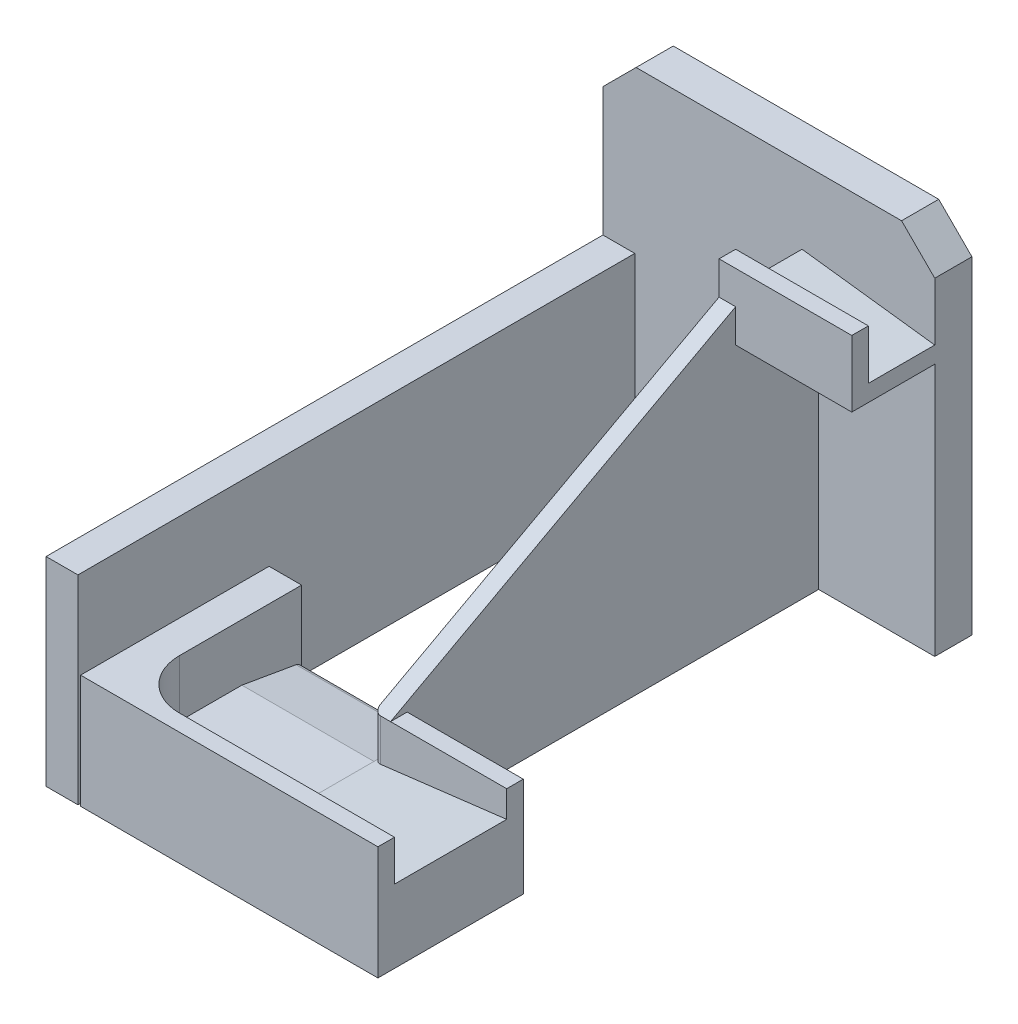
from build123d import *

# Parameters (mm, degrees)
EXTRUDE_1_DEPTH  = 5.6
SKETCH_3_W       = 20
SKETCH_3_H       = 10
EXTRUDE_2_DEPTH  = 2.5
EXTRUDE_3_REACH  = 77.491
EXTRUDE_4_DEPTH  = 2.5
SKETCH_7_W       = 28.4
SKETCH_7_H       = 17.12
EXTRUDE_5_DEPTH  = 4.9
SKETCH_8_W       = 39.9
SKETCH_8_H       = 17.12
EXTRUDE_6_DEPTH  = 2.5
SKETCH_9_W       = 17.5
SKETCH_9_H       = 15
EXTRUDE_7_DEPTH  = 2.5
EXTRUDE_8_DEPTH  = 19.9
FILLET_1_R       = 1
EXTRUDE_9_REACH  = 103.831
SKETCH_14_W      = 4.8
SKETCH_14_H      = 30
EXTRUDE_12_DEPTH = 83.9
EXTRUDE_13_DEPTH = 8.56
FILLET_3_R       = 1


with BuildPart() as part:
    # 草图1 → 凸台-拉伸1 (new body)
    with BuildSketch(Plane.XY):
        Polygon((0, 49.365), (5, 54.365), (45, 54.365), (50, 49.365), (50, 0), (0, 0), align=None)
    extrude(amount=EXTRUDE_1_DEPTH)

    # 草图5 → 凸台-拉伸3 (add, up to next)
    with BuildSketch(Plane(origin=(0, 0, 15.6), x_dir=(-1, 0, 0), z_dir=(0, 0, -1)), mode=Mode.PRIVATE) as extrude_3_sk1:
        Polygon((-30, 43.145), (-50, 40.645), (-50, 38.145), (-30, 38.145), align=None)
    extrude_3_tool1 = extrude(extrude_3_sk1.sketch, amount=EXTRUDE_3_REACH, mode=Mode.PRIVATE) - part.part


with BuildPart() as body_2:
    # 草图3 → 凸台-拉伸2 (new body)
    with BuildSketch(Plane.XY.offset(15.6)):
        with Locations((40, 43.145)):
            Rectangle(SKETCH_3_W, SKETCH_3_H)
    extrude(amount=EXTRUDE_2_DEPTH)


with BuildPart() as part_1:
    add(part.part)

    add(body_2.part)  # 凸台-拉伸3 merges body 2
    add(extrude_3_tool1.solids().sort_by_distance((38.888889, 40.089444, 15.6))[0])

    # 草图6 → 凸台-拉伸4 (add)
    with BuildSketch(Plane.ZY.offset(-30)):
        Polygon((18.1, 43.145), (70.1, 15), (70.1, 0), (5.6, 0), (5.6, 38.145), (18.1, 38.145), align=None)
    extrude(amount=-EXTRUDE_4_DEPTH)

    # 草图9 → 凸台-拉伸7 (add)
    with BuildSketch(Plane.XY.offset(70.1)):
        with Locations((41.25, 7.5)):
            Rectangle(SKETCH_9_W, SKETCH_9_H)
    extrude(amount=-EXTRUDE_7_DEPTH)



with BuildPart() as body_2_2:
    # 草图7 → 凸台-拉伸5 (new body)
    with BuildSketch(Plane.ZY.offset(-5.2)):
        with Locations((75.3, 8.56)):
            Rectangle(SKETCH_7_W, SKETCH_7_H)
    extrude(amount=-EXTRUDE_5_DEPTH)

    # 草图8 → 凸台-拉伸6 (add)
    with BuildSketch(Plane.XY.offset(89.5)):
        with Locations((30.05, 8.56)):
            Rectangle(SKETCH_8_W, SKETCH_8_H)
    extrude(amount=-EXTRUDE_6_DEPTH)


with BuildPart() as part_2:
    add(part_1.part)

    add(body_2_2.part)  # 凸台-拉伸8 merges body 2 2
    # 草图11 → 凸台-拉伸8 (add)
    with BuildSketch(Plane(origin=(10.1, 0, 0), x_dir=(0, 0, -1), z_dir=(1, 0, 0))):
        Polygon((-61.1, 0), (-61.1, 7), (-70.1, 8.56), (-87, 8.56), (-87, 0), align=None)
    extrude(amount=EXTRUDE_8_DEPTH)

    # 圆角1
    fillet_1_edges = [part_2.edges().sort_by_distance(p)[0] for p in [
        (20.05, 7, 61.1),
    ]]
    fillet(fillet_1_edges, radius=FILLET_1_R)

    # 草图12 → 凸台-拉伸9 (add, up to next)
    with BuildSketch(Plane.XY.offset(70.1), mode=Mode.PRIVATE) as extrude_9_sk1:
        Polygon((30, 0), (30, 8.56), (50, 11), (50, 0), align=None)
    extrude_9_tool1 = extrude(extrude_9_sk1.sketch, amount=EXTRUDE_9_REACH, mode=Mode.PRIVATE) - part_2.part
    add(extrude_9_tool1.solids().sort_by_distance((40.415815, 4.915365, 70.1))[0])

    # 草图14 → 凸台-拉伸12 (add)
    with BuildSketch(Plane.XY.offset(5.6)):
        with Locations((2.4, 15)):
            Rectangle(SKETCH_14_W, SKETCH_14_H)
    extrude(amount=EXTRUDE_12_DEPTH)

    # 草图15 → 凸台-拉伸13 (add)
    with BuildSketch(Plane(origin=(0, 8.56, 0), x_dir=(1, 0, 0), z_dir=(0, 1, 0))):
        with BuildLine():
            Line((10.1, -79.5), (10.1, -87))
            Line((10.1, -87), (17.6, -87))
            ThreePointArc((17.6, -87), (12.296699141, -84.803300859), (10.1, -79.5))
        make_face()
    extrude(amount=EXTRUDE_13_DEPTH)

    # 圆角3
    # the kernel refuses this fillet: 1 mm, written as the material it takes off along each edge
    with BuildSketch(Plane(origin=(30, 17.5, 70.1), x_dir=(0, 0, -1), z_dir=(0, -1, 0))) as fillet_3_piece_1_section:
        with BuildLine():
            CenterArc((FILLET_3_R, FILLET_3_R), FILLET_3_R, 180, 90)
            Line((0, FILLET_3_R), (0, 0))
            Line((0, 0), (FILLET_3_R, 0))
        make_face()
    fillet_3_piece_1 = extrude(amount=11.44, mode=Mode.PRIVATE)
    fillet_3_piece_1 = split(fillet_3_piece_1, bisect_by=Plane(origin=(30.761446194, 8.652896436, 69.873228865), z_dir=(-0.12110208706144665, 0.9926400578806811, 0)), keep=Keep.TOP, mode=Mode.PRIVATE)
    add(fillet_3_piece_1, mode=Mode.SUBTRACT)


solid = part_2.part
